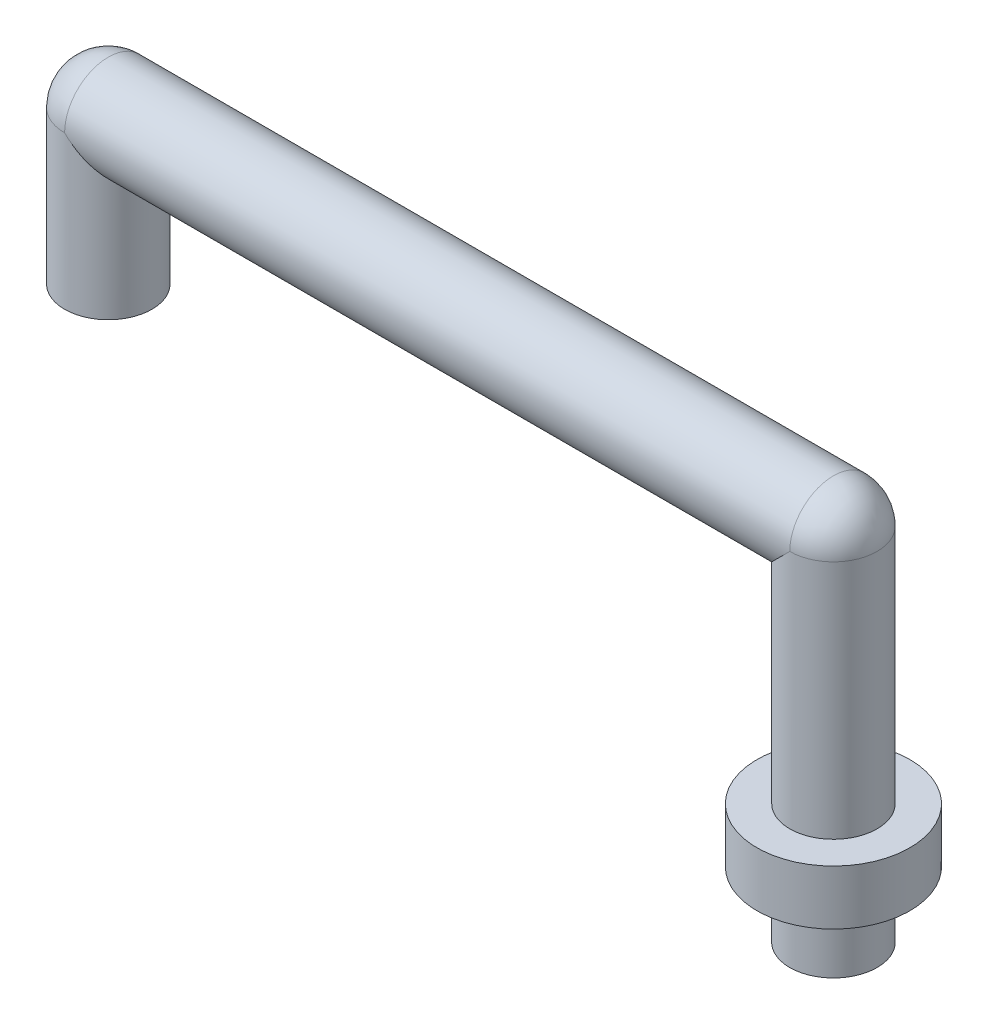
from build123d import *

# Parameters (mm, degrees)
SKETCH2_R           = 5.08
BOSS_EXTRUDE2_DEPTH = 41.91
SKETCH3_W           = 8.89
SKETCH3_H           = 6.35


with BuildPart() as part:
    # Sketch2 → Boss-Extrude2 (new body)
    with BuildSketch(Plane(origin=(0, 0, 0), x_dir=(-1, 0, 0), z_dir=(0, 1, 0))):
        Circle(SKETCH2_R)
    extrude(amount=BOSS_EXTRUDE2_DEPTH)

    # Sketch3 → Revolve1 (revolve)
    with BuildSketch(Plane.XY):
        with Locations((-4.445, 10.795)):
            Rectangle(SKETCH3_W, SKETCH3_H)
    revolve(axis=Axis((0, 0, 0), (0, 1, 0)))

    # Sketch4 → Revolve2 (revolve)
    with BuildSketch(Plane(origin=(0, 41.91, 0), x_dir=(1, 0, 0), z_dir=(0, 1, 0))):
        with BuildLine():
            Line((0, 5.08), (-84.328, 5.08))
            Line((-84.328, 5.08), (-84.328, 0))
            Line((-84.328, 0), (5.08, 0))
            ThreePointArc((5.08, 0), (3.592102448, 3.592102448), (0, 5.08))
        make_face()
    revolve(axis=Axis((-84.328, 41.91, 0), (1, 0, 0)))

    # Sketch5 → Revolve3 (revolve)
    with BuildSketch(Plane.ZY.offset(84.328)):
        with BuildLine():
            Line((0, 46.99), (0, 24.13))
            Line((0, 24.13), (-5.08, 24.13))
            Line((-5.08, 24.13), (-5.08, 41.91))
            ThreePointArc((-5.08, 41.91), (-3.592102448, 45.502102448), (0, 46.99))
        make_face()
    revolve(axis=Axis((-84.328, 46.99, 0), (0, -1, 0)))


solid = part.part
